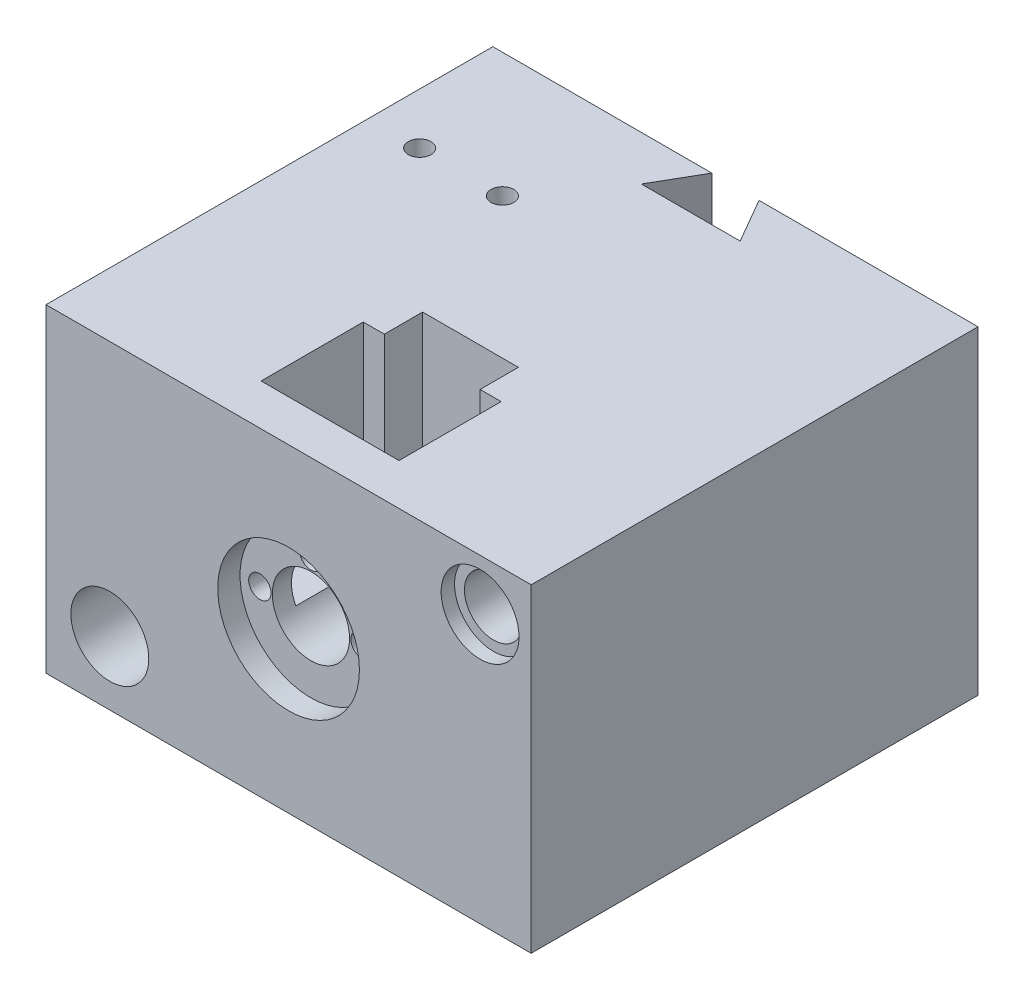
from build123d import *

# Parameters (mm, degrees)
SKETCH1_W                       = 38
SKETCH1_H                       = 50
BOSS_EXTRUDE1_DEPTH             = 70
CUT_EXTRUDE1_DEPTH              = 50
SKETCH8_R                       = 3.25
SKETCH8_R_2                     = 4.15
CUT_EXTRUDE7_DEPTH              = 58
SKETCH42_R                      = 6.1
SKETCH42_R_2                    = 3.25
CUT_EXTRUDE30_DEPTH             = 21
SKETCH43_R                      = 4.55
SKETCH43_R_2                    = 3.25
CUT_EXTRUDE31_DEPTH             = 11.1
SKETCH44_R                      = 6.1
SKETCH44_R_2                    = 4.55
CUT_EXTRUDE32_DEPTH             = 2.1
SKETCH10_R                      = 11.1
CUT_EXTRUDE8_DEPTH              = 3.5
SKETCH11_R                      = 6.05
CUT_EXTRUDE9_DEPTH              = 19
SKETCH12_R                      = 6.05
CUT_EXTRUDE10_DEPTH             = 6
CUT_EXTRUDE11_START             = -16
CUT_EXTRUDE11_DEPTH             = 16
SKETCH14_R                      = 1.75
CUT_EXTRUDE12_DEPTH             = 19
CIRPATTERN1_COUNT               = 2
CIRPATTERN1_ANGLE               = 90
CIRPATTERN1_THE_OTHER_WAY_COUNT = 2
CIRPATTERN1_THE_OTHER_WAY_ANGLE = 90
SKETCH15_R                      = 1.75
CUT_EXTRUDE13_DEPTH             = 16
BOSS_EXTRUDE4_DEPTH             = 12
SKETCH18_W                      = 24
SKETCH18_H                      = 19.482903768
BOSS_EXTRUDE5_DEPTH             = 30
BOSS_EXTRUDE15_DEPTH            = 4.73424
BOSS_EXTRUDE15_START            = -38
BOSS_EXTRUDE15_2_DEPTH          = 7.26576
BOSS_EXTRUDE15_START_2          = -63.25
BOSS_EXTRUDE15_3_DEPTH          = 38.25
BOSS_EXTRUDE6_DEPTH             = 12
SKETCH20_W                      = 12
SKETCH20_H                      = 19.482903768
BOSS_EXTRUDE7_DEPTH             = 36
SKETCH22_W                      = 8
SKETCH22_H                      = 10
SKETCH22_R                      = 2.4
BOSS_EXTRUDE8_DEPTH             = 7
SKETCH37_R                      = 2.4
CUT_EXTRUDE25_DEPTH             = 2.1
BOSS_EXTRUDE9_DEPTH             = 9
SKETCH25_R                      = 2
CUT_EXTRUDE15_DEPTH             = 10
BOSS_EXTRUDE10_DEPTH            = 8.5
BOSS_EXTRUDE10_2_DEPTH          = 8.5
SKETCH27_R                      = 1.75
CUT_EXTRUDE16_DEPTH             = 10
CUT_EXTRUDE17_DEPTH             = 8.5
BOSS_EXTRUDE11_DEPTH            = 7
SKETCH30_W                      = 5
SKETCH30_H                      = 29.277350269
BOSS_EXTRUDE12_DEPTH            = 38
SKETCH31_R                      = 2.5
BOSS_EXTRUDE13_DEPTH            = 6
BOSS_EXTRUDE14_DEPTH            = 1
SKETCH33_R                      = 1.75
CUT_EXTRUDE21_DEPTH             = 12
SKETCH34_R                      = 7
CUT_EXTRUDE22_DEPTH             = 1
SKETCH35_RX                     = 2
SKETCH35_RY                     = 0.5
CUT_EXTRUDE23_DEPTH             = 5
SKETCH36_R                      = 2.9
CUT_EXTRUDE24_DEPTH             = 3.8
CUT_EXTRUDE26_DEPTH             = 2
SKETCH39_R                      = 1.775
CUT_EXTRUDE27_DEPTH             = 18
CUT_EXTRUDE28_DEPTH             = 96
CUT_EXTRUDE29_DEPTH             = 26.777350269
SKETCH45_R                      = 1.8
CUT_EXTRUDE33_DEPTH             = 10
CUT_EXTRUDE35_DEPTH             = 2
SKETCH53_W                      = 10
SKETCH53_H                      = 21
CUT_EXTRUDE37_DEPTH             = 19.482903769
SKETCH51_W                      = 69.339188828
SKETCH51_H                      = 40.209452119
CUT_EXTRUDE36_DEPTH             = 76


with BuildPart() as part:
    # Sketch1 → Boss-Extrude1 (new body)
    with BuildSketch(Plane.XY):
        with Locations((-19, 0)):
            Rectangle(SKETCH1_W, SKETCH1_H)
    boss_extrude1 = extrude(amount=BOSS_EXTRUDE1_DEPTH)

    # Sketch2 → Cut-Extrude1 (cut)
    with BuildSketch(Plane(origin=(-20, -25, 0), x_dir=(0, 0, -1), z_dir=(0, 1, 0))):
        Polygon((0, -20), (0, -16.3), (-7, -12.258548116), (-7, -20), align=None)
    cut_extrude1 = extrude(amount=CUT_EXTRUDE1_DEPTH, mode=Mode.SUBTRACT)

    # Mirror1: Boss-Extrude1, Cut-Extrude1 across plane
    add(boss_extrude1.mirror(Plane(origin=(0, 0, 0), x_dir=(0, 0, 1), z_dir=(1, 0, 0))))
    add(cut_extrude1.mirror(Plane(origin=(0, 0, 0), x_dir=(0, 0, 1), z_dir=(1, 0, 0))), mode=Mode.SUBTRACT)

    # Sketch8 → Cut-Extrude7 (cut)
    with BuildSketch(Plane.XY.offset(70)):
        with Locations((-28, -15)):
            Circle(SKETCH8_R)
        Circle(SKETCH8_R_2)
        with Locations((30, 17)):
            Circle(SKETCH8_R)
    extrude(amount=-CUT_EXTRUDE7_DEPTH, mode=Mode.SUBTRACT)

    # Sketch42 → Cut-Extrude30 (cut)
    with BuildSketch(Plane.XY.offset(70)):
        with Locations((-28, -15)):
            Circle(SKETCH42_R)
        with Locations((-28, -15)):
            Circle(SKETCH42_R_2, mode=Mode.SUBTRACT)
    extrude(amount=-CUT_EXTRUDE30_DEPTH, mode=Mode.SUBTRACT)

    # Sketch43 → Cut-Extrude31 (cut)
    with BuildSketch(Plane.XY.offset(70)):
        with Locations((30, 17)):
            Circle(SKETCH43_R)
        with Locations((30, 17)):
            Circle(SKETCH43_R_2, mode=Mode.SUBTRACT)
    extrude(amount=-CUT_EXTRUDE31_DEPTH, mode=Mode.SUBTRACT)

    # Sketch44 → Cut-Extrude32 (cut)
    with BuildSketch(Plane.XY.offset(70)):
        with Locations((30, 17)):
            Circle(SKETCH44_R)
        with Locations((30, 17)):
            Circle(SKETCH44_R_2, mode=Mode.SUBTRACT)
    extrude(amount=-CUT_EXTRUDE32_DEPTH, mode=Mode.SUBTRACT)

    # Sketch10 → Cut-Extrude8 (cut)
    with BuildSketch(Plane.XY.offset(70)):
        Circle(SKETCH10_R)
    extrude(amount=-CUT_EXTRUDE8_DEPTH, mode=Mode.SUBTRACT)

    # Sketch11 → Cut-Extrude9 (cut)
    with BuildSketch(Plane.XY.offset(66.5)):
        Circle(SKETCH11_R)
    extrude(amount=-CUT_EXTRUDE9_DEPTH, mode=Mode.SUBTRACT)

    # Sketch12 → Cut-Extrude10 (cut)
    # profile 1 of 2: a face of its own
    with BuildSketch(Plane.XY.offset(47.5)):
        with BuildLine():
            Line((7.5, 0), (7.5, 25))
            Line((7.5, 25), (-7.5, 25))
            Line((-7.5, 25), (-7.5, 0))
            ThreePointArc((-7.5, 0), (0, -7.5), (7.5, 0))
        make_face()
        Circle(SKETCH12_R, mode=Mode.SUBTRACT)
    # profile 2 of 2: a face of its own
    with BuildSketch(Plane.XY.offset(47.5)):
        Circle(SKETCH12_R)
    extrude(amount=-CUT_EXTRUDE10_DEPTH, mode=Mode.SUBTRACT)

    # Sketch13 → Cut-Extrude11 (cut)
    with BuildSketch(Plane(origin=(0, 0, 47.5), x_dir=(-1, 0, 0), z_dir=(0, 0, -1)).offset(CUT_EXTRUDE11_START)):
        with BuildLine():
            Line((-6.05, 25), (-6.05, 0))
            ThreePointArc((-6.05, 0), (0, 6.05), (6.05, 0))
            Line((6.05, 0), (6.05, 25))
            Line((6.05, 25), (-6.05, 25))
        make_face()
    extrude(amount=CUT_EXTRUDE11_DEPTH, mode=Mode.SUBTRACT)

    # Sketch14 → Cut-Extrude12 (cut)
    with BuildSketch(Plane.XY.offset(66.5)):
        with Locations((0, 8)):
            Circle(SKETCH14_R)
    cut_extrude12 = extrude(amount=-CUT_EXTRUDE12_DEPTH, mode=Mode.SUBTRACT)

    # CirPattern1: Cut-Extrude12 ×2 about axis
    cirpattern1_axis = Axis((0, 0, 12), (0, 0, 1))
    for i in range(1, CIRPATTERN1_COUNT):
        add(cut_extrude12.rotate(cirpattern1_axis, i * CIRPATTERN1_ANGLE / (CIRPATTERN1_COUNT - 1)), mode=Mode.SUBTRACT)

    # CirPattern1 the other way: Cut-Extrude12 ×2 about axis
    cirpattern1_the_other_way_axis = Axis((0, 0, 12), (0, 0, -1))
    for i in range(1, CIRPATTERN1_THE_OTHER_WAY_COUNT):
        add(cut_extrude12.rotate(cirpattern1_the_other_way_axis, i * CIRPATTERN1_THE_OTHER_WAY_ANGLE / (CIRPATTERN1_THE_OTHER_WAY_COUNT - 1)), mode=Mode.SUBTRACT)

    # Sketch15 → Cut-Extrude13 (cut)
    # profile 1 of 2: a face of its own
    with BuildSketch(Plane(origin=(0, 0, 63.5), x_dir=(-1, 0, 0), z_dir=(0, 0, -1))):
        with BuildLine():
            Line((-6.05, 25), (-6.05, 0))
            ThreePointArc((-6.05, 0), (0, 6.05), (6.05, 0))
            Line((6.05, 0), (6.05, 25))
            Line((6.05, 25), (-6.05, 25))
        make_face()
        with Locations(Location((0, 8, 0), (0, 0, 180))):
            Circle(SKETCH15_R, mode=Mode.SUBTRACT)
    # profile 2 of 2: a face of its own
    with BuildSketch(Plane(origin=(0, 0, 63.5), x_dir=(-1, 0, 0), z_dir=(0, 0, -1))):
        with BuildLine():
            Line((-10.8, 25), (-10.8, -2.8))
            Line((-10.8, -2.8), (10.8, -2.8))
            Line((10.8, -2.8), (10.8, 25))
            Line((10.8, 25), (6.05, 25))
            Line((6.05, 25), (6.05, 0))
            ThreePointArc((6.05, 0), (0, 6.05), (-6.05, 0))
            Line((-6.05, 0), (-6.05, 25))
            Line((-6.05, 25), (-10.8, 25))
        make_face()
        with Locations(Location((-8, 0, 0), (0, 0, 270))):
            Circle(SKETCH15_R, mode=Mode.SUBTRACT)
        with Locations(Location((8, 0, 0), (0, 0, 90))):
            Circle(SKETCH15_R, mode=Mode.SUBTRACT)
    extrude(amount=CUT_EXTRUDE13_DEPTH, mode=Mode.SUBTRACT)

    # Sketch17 → Boss-Extrude4 (add)
    with BuildSketch(Plane.ZY.offset(26)):
        Polygon((42.083647797, -25), (20, -63.25), (20, -25), align=None)
        Polygon((38.619546181, -27), (22, -55.785898385), (22, -27), align=None, mode=Mode.SUBTRACT)
    extrude(amount=-BOSS_EXTRUDE4_DEPTH)

    # Sketch18 → Boss-Extrude5 (add)
    with BuildSketch(Plane(origin=(0, 0, 20), x_dir=(-1, 0, 0), z_dir=(0, 0, -1))):
        with Locations((26, -42.08)):
            Rectangle(SKETCH18_W, SKETCH18_H)
        Polygon((37.2, -49.821451884), (30.2, -45.78), (30.2, -38.38), (37.2, -34.338548116), align=None, mode=Mode.SUBTRACT)
    extrude(amount=BOSS_EXTRUDE5_DEPTH)

    # Boss-Extrude15: read off the stored shape, not the designer's step
    # Boss-Extrude15 outline → Boss-Extrude15 (add)
    with BuildSketch(Plane.ZY.offset(26)):
        Polygon((20, -25), (20, -63.25), (42.083647797, -25), align=None)
        Polygon((38.619546181, -27), (22, -55.785898385), (22, -27), align=None, mode=Mode.SUBTRACT)
    extrude(amount=BOSS_EXTRUDE15_DEPTH)

    # Boss-Extrude15 2 outline → Boss-Extrude15 2 (add)
    with BuildSketch(Plane.YZ.offset(BOSS_EXTRUDE15_START)):
        Polygon((-63.25, 20), (-25, 20), (-25, 42.083647797), align=None)
        Polygon((-27, 38.619546181), (-27, 22), (-55.785898385, 22), align=None, mode=Mode.SUBTRACT)
    extrude(amount=BOSS_EXTRUDE15_2_DEPTH)

    # Boss-Extrude15 3 outline → Boss-Extrude15 3 (cut)
    with BuildSketch(Plane(origin=(0, 0, 0), x_dir=(1, 0, 0), z_dir=(0, 1, 0)).offset(BOSS_EXTRUDE15_START_2)):
        Polygon((-26, -42.083647797), (-38, -20), (-39, -18.159696017), (-39, -44), (-24.958676273, -44), align=None)
    extrude(amount=BOSS_EXTRUDE15_3_DEPTH, mode=Mode.SUBTRACT)

    # Sketch19 → Boss-Extrude6 (add)
    with BuildSketch(Plane(origin=(36, 0, 0), x_dir=(0, 0, -1), z_dir=(1, 0, 0))):
        Polygon((-20, -25), (-42.083647797, -25), (-20, -63.25), align=None)
        Polygon((-22, -27), (-22, -55.785898385), (-38.619546181, -27), align=None, mode=Mode.SUBTRACT)
    extrude(amount=-BOSS_EXTRUDE6_DEPTH)

    # Sketch20 → Boss-Extrude7 (add)
    with BuildSketch(Plane(origin=(0, 0, 20), x_dir=(-1, 0, 0), z_dir=(0, 0, -1))):
        with Locations((-30, -42.08)):
            Rectangle(SKETCH20_W, SKETCH20_H)
        Polygon((-33, -49.621451884), (-33, -34.538548116), (-26, -38.58), (-26, -45.58), align=None, mode=Mode.SUBTRACT)
    extrude(amount=BOSS_EXTRUDE7_DEPTH)

    # Sketch22 → Boss-Extrude8 (add)
    with BuildSketch(Plane(origin=(0, 0, -16), x_dir=(-1, 0, 0), z_dir=(0, 0, -1))):
        with Locations((-20, -42.08)):
            Rectangle(SKETCH22_W, SKETCH22_H)
        with Locations(Location((-20, -42.08, 0), (0, 0, 90))):
            Circle(SKETCH22_R, mode=Mode.SUBTRACT)
    extrude(amount=-BOSS_EXTRUDE8_DEPTH)

    # Sketch37 → Cut-Extrude25 (cut)
    with BuildSketch(Plane(origin=(0, 0, -16), x_dir=(-1, 0, 0), z_dir=(0, 0, -1))):
        Polygon((-18.166912895, -38.905), (-21.833087105, -38.905), (-23.666174209, -42.08), (-21.833087105, -45.255), (-18.166912895, -45.255), (-16.333825791, -42.08), align=None)
        with Locations(Location((-20, -42.08, 0), (0, 0, 90))):
            Circle(SKETCH37_R, mode=Mode.SUBTRACT)
    extrude(amount=-CUT_EXTRUDE25_DEPTH, mode=Mode.SUBTRACT)

    # Sketch24 → Boss-Extrude9 (add)
    with BuildSketch(Plane.ZY.offset(21.5)):
        Polygon((8.5, 55), (8.5, 25), (47, 25), (8.5, 63.5), (1.5, 63.5), (1.5, 55), align=None)
        Polygon((10.5, 27), (10.5, 58.671572875), (42.171572875, 27), align=None, mode=Mode.SUBTRACT)
    extrude(amount=-BOSS_EXTRUDE9_DEPTH)

    # Sketch25 → Cut-Extrude15 (cut)
    with BuildSketch(Plane.XZ.offset(-55)):
        with Locations(Location((-17, 5, 0), (0, 0, 270))):
            Circle(SKETCH25_R)
    extrude(amount=-CUT_EXTRUDE15_DEPTH, mode=Mode.SUBTRACT)

    # Sketch26<3> → Cut-Extrude17 (cut)
    with BuildSketch(Plane(origin=(0, 63.5, 0), x_dir=(1, 0, 0), z_dir=(0, 1, 0))):
        with BuildLine():
            Line((-14.103420078, -1.5), (-19.896579922, -1.5))
            ThreePointArc((-19.896579922, -1.5), (-17, -1.802926416), (-14.103420078, -1.5))
        make_face()
    extrude(amount=-CUT_EXTRUDE17_DEPTH, mode=Mode.SUBTRACT)



with BuildPart() as body_2:
    # Sketch26 → Boss-Extrude10 (new body)
    with BuildSketch(Plane(origin=(0, 63.5, 0), x_dir=(1, 0, 0), z_dir=(0, 1, 0))):
        with BuildLine():
            ThreePointArc((-22.075186591, 27.67257884), (-30.311604201, 21.897780646), (-33.473693864, 12.348536792))
            Line((-33.473693864, 12.348536792), (-33.473693864, -8.5))
            Line((-33.473693864, -8.5), (-26.473693864, -8.5))
            Line((-26.473693864, -8.5), (-26.473693864, -0.880219764))
            Line((-26.473693864, -0.880219764), (-21.5, -8.5))
            Line((-21.5, -8.5), (-21.5, -6.670498963))
            Line((-21.5, -6.670498963), (-24.546408047, -2.003352076))
            ThreePointArc((-24.546408047, -2.003352076), (-23.331001026, -2.540786658), (-22.075186591, -2.975505256))
            Line((-22.075186591, -2.975505256), (-21.5, -3.148221887))
            Line((-21.5, -3.148221887), (-21.5, -1.5))
            Line((-21.5, -1.5), (-19.896579922, -1.5))
            ThreePointArc((-19.896579922, -1.5), (-20.704827747, -1.303824585), (-21.5, -1.06))
            ThreePointArc((-21.5, -1.06), (-31.473693864, 12.348536792), (-21.5, 25.757073584))
            ThreePointArc((-21.5, 25.757073584), (-17, 26.5), (-12.5, 25.757073584))
            Line((-12.5, 25.757073584), (-12.5, 33.757073584))
            Line((-12.5, 33.757073584), (-21.5, 33.757073584))
            Line((-21.5, 33.757073584), (-21.5, 27.84529547))
            Line((-21.5, 27.84529547), (-22.075186591, 27.67257884))
        make_face()
    extrude(amount=-BOSS_EXTRUDE10_DEPTH)

    # Sketch27 → Cut-Extrude16 (cut)
    with BuildSketch(Plane(origin=(0, 63.5, 0), x_dir=(1, 0, 0), z_dir=(0, 1, 0))):
        with Locations((-17, 30)):
            Circle(SKETCH27_R)
        with BuildLine():
            Line((-17, 31.75), (-18.5, 31.75))
            ThreePointArc((-18.5, 31.75), (-20.25, 30), (-18.5, 28.25))
            Line((-18.5, 28.25), (-17, 28.25))
            ThreePointArc((-17, 28.25), (-18.75, 30), (-17, 31.75))
        make_face()
        with BuildLine():
            Line((-15.5, 31.75), (-17, 31.75))
            ThreePointArc((-17, 31.75), (-15.762563133, 31.237436867), (-15.25, 30))
            ThreePointArc((-15.25, 30), (-15.762563133, 28.762563133), (-17, 28.25))
            Line((-17, 28.25), (-15.5, 28.25))
            ThreePointArc((-15.5, 28.25), (-13.75, 30), (-15.5, 31.75))
        make_face()
    extrude(amount=-CUT_EXTRUDE16_DEPTH, mode=Mode.SUBTRACT)


with BuildPart() as body_3:
    # Sketch26 → Boss-Extrude10 2 (new body)
    with BuildSketch(Plane(origin=(0, 63.5, 0), x_dir=(1, 0, 0), z_dir=(0, 1, 0))):
        with BuildLine():
            ThreePointArc((-12.5, -1.06), (-13.295172253, -1.303824585), (-14.103420078, -1.5))
            Line((-14.103420078, -1.5), (-12.5, -1.5))
            Line((-12.5, -1.5), (-12.5, -1.06))
        make_face()
    extrude(amount=-BOSS_EXTRUDE10_2_DEPTH)


with BuildPart() as part_1:
    add(part.part)

    add(body_2.part)  # Boss-Extrude11 merges body 2
    # Sketch29 → Boss-Extrude11 (add)
    with BuildSketch(Plane.ZY.offset(33.473693864)):
        Polygon((8.5, 63.5), (8.5, 55), (8.5, 25), (47, 25), align=None)
        Polygon((10.5, 55), (10.5, 58.671572875), (42.171572875, 27), (10.5, 27), align=None, mode=Mode.SUBTRACT)
    extrude(amount=-BOSS_EXTRUDE11_DEPTH)

    # Sketch30 → Boss-Extrude12 (add)
    with BuildSketch(Plane.ZY.offset(-24)):
        with Locations((19.5, -44.477223251)):
            Rectangle(SKETCH30_W, SKETCH30_H)
    extrude(amount=BOSS_EXTRUDE12_DEPTH)

    # Sketch31 → Boss-Extrude13 (add)
    with BuildSketch(Plane(origin=(0, 0, 17), x_dir=(-1, 0, 0), z_dir=(0, 0, -1))):
        with Locations(Location((-12.071067812, -35.014830573, 0), (0, 0, 180))):
            Circle(SKETCH31_R)
        with Locations(Location((2.071067812, -35.014830573, 0), (0, 0, 180))):
            Circle(SKETCH31_R)
        with Locations(Location((2.071067812, -49.156966197, 0), (0, 0, 180))):
            Circle(SKETCH31_R)
        with Locations(Location((-12.071067812, -49.156966197, 0), (0, 0, 180))):
            Circle(SKETCH31_R)
    extrude(amount=BOSS_EXTRUDE13_DEPTH)

    # Sketch32 → Boss-Extrude14 (add)
    with BuildSketch(Plane(origin=(0, 0, 11), x_dir=(-1, 0, 0), z_dir=(0, 0, -1))):
        with BuildLine():
            Line((-12.571067812, -32.514830573), (2.571067812, -32.514830573))
            ThreePointArc((2.571067812, -32.514830573), (3.985281374, -33.100617011), (4.571067812, -34.514830573))
            Line((4.571067812, -34.514830573), (4.571067812, -49.656966197))
            ThreePointArc((4.571067812, -49.656966197), (3.985281374, -51.071179759), (2.571067812, -51.656966197))
            Line((2.571067812, -51.656966197), (-12.571067812, -51.656966197))
            ThreePointArc((-12.571067812, -51.656966197), (-13.985281374, -51.071179759), (-14.571067812, -49.656966197))
            Line((-14.571067812, -49.656966197), (-14.571067812, -34.514830573))
            ThreePointArc((-14.571067812, -34.514830573), (-13.985281374, -33.100617011), (-12.571067812, -32.514830573))
        make_face()
    extrude(amount=BOSS_EXTRUDE14_DEPTH)

    # Sketch33 → Cut-Extrude21 (cut)
    with BuildSketch(Plane(origin=(0, 0, 10), x_dir=(-1, 0, 0), z_dir=(0, 0, -1))):
        with Locations((-12.071067812, -35.014830573)):
            Circle(SKETCH33_R)
        with Locations((-12.071067812, -49.156966197)):
            Circle(SKETCH33_R)
        with Locations((2.071067812, -35.014830573)):
            Circle(SKETCH33_R)
        with Locations((2.071067812, -49.156966197)):
            Circle(SKETCH33_R)
    extrude(amount=-CUT_EXTRUDE21_DEPTH, mode=Mode.SUBTRACT)

    # Sketch34 → Cut-Extrude22 (cut)
    with BuildSketch(Plane(origin=(0, 0, 10), x_dir=(-1, 0, 0), z_dir=(0, 0, -1))):
        with Locations((-5, -42.085898385)):
            Circle(SKETCH34_R)
    extrude(amount=-CUT_EXTRUDE22_DEPTH, mode=Mode.SUBTRACT)

    # Sketch35 → Cut-Extrude23 (cut)
    with BuildSketch(Plane(origin=(0, 0, 17), x_dir=(-1, 0, 0), z_dir=(0, 0, -1))):
        with Locations((-5, -42.085898385)):
            Ellipse(SKETCH35_RX, SKETCH35_RY)
    extrude(amount=-CUT_EXTRUDE23_DEPTH, mode=Mode.SUBTRACT)

    # Sketch36 → Cut-Extrude24 (cut)
    with BuildSketch(Plane(origin=(0, 0, 17), x_dir=(-1, 0, 0), z_dir=(0, 0, -1))):
        with Locations((-5, -42.085898385)):
            Circle(SKETCH36_R)
    extrude(amount=-CUT_EXTRUDE24_DEPTH, mode=Mode.SUBTRACT)

    # Sketch38 → Cut-Extrude26 (cut)
    with BuildSketch(Plane(origin=(0, 27, 0), x_dir=(1, 0, 0), z_dir=(0, 1, 0))):
        with BuildLine():
            Line((-31.723693864, -15.5), (-31.723693864, -23.5))
            ThreePointArc((-31.723693864, -23.5), (-29.973693864, -25.25), (-28.223693864, -23.5))
            Line((-28.223693864, -23.5), (-28.223693864, -15.5))
            ThreePointArc((-28.223693864, -15.5), (-29.973693864, -13.75), (-31.723693864, -15.5))
        make_face()
        with BuildLine():
            Line((-18.75, -15.5), (-18.75, -23.5))
            ThreePointArc((-18.75, -23.5), (-17, -25.25), (-15.25, -23.5))
            Line((-15.25, -23.5), (-15.25, -15.5))
            ThreePointArc((-15.25, -15.5), (-17, -13.75), (-18.75, -15.5))
        make_face()
    extrude(amount=-CUT_EXTRUDE26_DEPTH, mode=Mode.SUBTRACT)

    # Sketch39 → Cut-Extrude27 (cut)
    with BuildSketch(Plane(origin=(0, 25, 0), x_dir=(1, 0, 0), z_dir=(0, 1, 0))):
        with Locations(Location((-29.973693864, -19.5, 0), (0, 0, 180))):
            Circle(SKETCH39_R)
        with Locations(Location((-17, -19.5, 0), (0, 0, 180))):
            Circle(SKETCH39_R)
    extrude(amount=-CUT_EXTRUDE27_DEPTH, mode=Mode.SUBTRACT)


with BuildPart() as body_3_2:
    # Split1: read off the stored shape, not the designer's step
    # Split1: the piece on the far side of the plane
    add(part_1.part)
    split(bisect_by=Plane(origin=(0, 25, 0), x_dir=(1, 0, 0), z_dir=(0, 1, 0)), keep=Keep.BOTTOM)

    # Sketch41 → Cut-Extrude29 (cut)
    with BuildSketch(Plane.XZ.offset(59.115898385)):
        Polygon((-6.25571681, 17), (-5.385473361, 8.406534471), (16.679408912, 8.406534471), (16.679408912, 17), align=None)
    extrude(amount=-CUT_EXTRUDE29_DEPTH, mode=Mode.SUBTRACT)

    # Sketch45 → Cut-Extrude33 (cut)
    with BuildSketch(Plane.XZ.offset(27)):
        with Locations(Location((-20.95, 28, 0), (0, 0, 270))):
            Circle(SKETCH45_R)
        with Locations(Location((30, 28, 0), (0, 0, 270))):
            Circle(SKETCH45_R)
    extrude(amount=-CUT_EXTRUDE33_DEPTH, mode=Mode.SUBTRACT)

    # Sketch50 → Cut-Extrude35 (cut)
    with BuildSketch(Plane.XZ.offset(27)):
        with BuildLine():
            Line((-22.75, 30.5), (-22.75, 28))
            ThreePointArc((-22.75, 28), (-20.95, 29.8), (-19.15, 28))
            Line((-19.15, 28), (-19.15, 30.5))
            ThreePointArc((-19.15, 30.5), (-20.95, 32.3), (-22.75, 30.5))
        make_face()
        with BuildLine():
            Line((-22.75, 28), (-22.75, 25.5))
            ThreePointArc((-22.75, 25.5), (-20.95, 23.7), (-19.15, 25.5))
            Line((-19.15, 25.5), (-19.15, 28))
            ThreePointArc((-19.15, 28), (-20.95, 26.2), (-22.75, 28))
        make_face()
        with BuildLine():
            Line((28.2, 30.5), (28.2, 28))
            ThreePointArc((28.2, 28), (30, 29.8), (31.8, 28))
            Line((31.8, 28), (31.8, 30.5))
            ThreePointArc((31.8, 30.5), (30, 32.3), (28.2, 30.5))
        make_face()
        with BuildLine():
            Line((28.2, 28), (28.2, 25.5))
            ThreePointArc((28.2, 25.5), (30, 23.7), (31.8, 25.5))
            Line((31.8, 25.5), (31.8, 28))
            ThreePointArc((31.8, 28), (30, 26.2), (28.2, 28))
        make_face()
    extrude(amount=-CUT_EXTRUDE35_DEPTH, mode=Mode.SUBTRACT)

    # Sketch53 → Cut-Extrude37 (cut)
    with BuildSketch(Plane.XZ.offset(51.821451884)):
        with Locations((-19, 0.5)):
            Rectangle(SKETCH53_W, SKETCH53_H)
    extrude(amount=-CUT_EXTRUDE37_DEPTH, mode=Mode.SUBTRACT)


with BuildPart() as part_2:
    add(part_1.part)

    # Split1
    split(bisect_by=Plane(origin=(0, 25, 0), x_dir=(1, 0, 0), z_dir=(0, 1, 0)), keep=Keep.TOP)


with BuildPart() as cut_extrude28_tool:
    # Sketch40 → Cut-Extrude28 (new body)
    with BuildSketch(Plane.ZY.offset(38)):
        Polygon((0, 25), (-60.44299001, 25), (-60.44299001, 86.660326125), (64.099076927, 86.660326125), (63.5, 25), align=None)
    extrude(amount=-CUT_EXTRUDE28_DEPTH)


with BuildPart() as part_3:
    add(part_2.part)

    # Cut-Extrude28: cut by cut_extrude28_tool
    add(cut_extrude28_tool.part, mode=Mode.SUBTRACT)


with BuildPart() as body_3_1:
    add(body_3.part)

    # Cut-Extrude28: cut by cut_extrude28_tool
    add(cut_extrude28_tool.part, mode=Mode.SUBTRACT)


with BuildPart() as body_2_2:
    # Split3: read off the stored shape, not the designer's step
    # Split3: the piece on the far side of the plane
    add(body_3_2.part)
    split(bisect_by=Plane(origin=(0, -25, 0), x_dir=(1, 0, 0), z_dir=(0, 1, 0)), keep=Keep.BOTTOM)

    # Sketch51 → Cut-Extrude36 (cut)
    with BuildSketch(Plane(origin=(38, 0, 0), x_dir=(0, 0, -1), z_dir=(1, 0, 0))):
        with Locations((-10.97062535, -45.10472606)):
            Rectangle(SKETCH51_W, SKETCH51_H)
    extrude(amount=-CUT_EXTRUDE36_DEPTH, mode=Mode.SUBTRACT)


with BuildPart() as body_3_2_1:
    add(body_3_2.part)

    # Split3
    split(bisect_by=Plane(origin=(0, -25, 0), x_dir=(1, 0, 0), z_dir=(0, 1, 0)), keep=Keep.TOP)


solid = body_3_2_1.part
